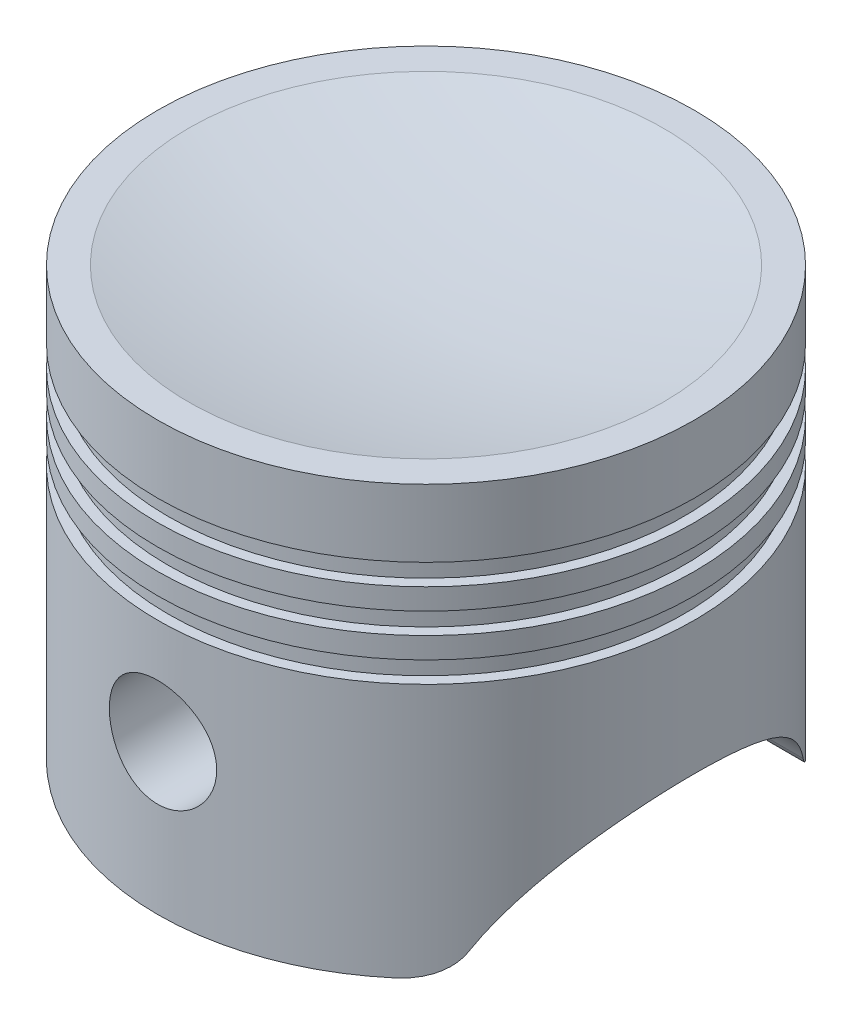
from build123d import *

# Parameters (mm, degrees)
SKETCH2_W                = 2.5
SKETCH2_H                = 5
LPATTERN1_COUNT          = 3
LPATTERN1_PITCH          = 10
CUT_EXTRUDE1_DEPTH       = 118.194667114
CUT_EXTRUDE1_DEPTH_BACK  = 118.194667114
SKETCH3_R                = 12.7
CUT_EXTRUDE3_DEPTH       = 118.194667288
CUT_EXTRUDE3_DEPTH_BACK  = 118.194667288
FILLET1_R                = 10
BOSS_EXTRUDE1_REACH      = 149.195
BOSS_EXTRUDE1_END_RADIUS = 57.15
BOSS_EXTRUDE1_START      = 30
SKETCH5_R                = 15.2
SKETCH5_R_2              = 12.7


with BuildPart() as part:
    # Sketch1 → Revolve1 (revolve)
    with BuildSketch(Plane.XY, mode=Mode.PRIVATE) as revolve1_sk:
        with BuildLine():
            Line((0, 19), (0, 0))
            Line((0, 0), (57.15, 0))
            Line((57.15, 0), (57.15, -75.3))
            Line((57.15, -75.3), (63.5, -75.3))
            Line((63.5, -75.3), (63.5, 26))
            Line((63.5, 26), (56.15, 26))
            ThreePointArc((56.15, 26), (28.278100119, 20.870846903), (0, 19))
        make_face()
    revolve(revolve1_sk.sketch.rotate(Axis((0, 19, 0), (0, -1, 0)), 180), axis=Axis((0, 19, 0), (0, -1, 0)))

    # Sketch2 → Cut-Revolve1 (revolve, cut)
    with BuildSketch(Plane.XY, mode=Mode.PRIVATE) as cut_revolve1_sk:
        with Locations((62.25, 7.5)):
            Rectangle(SKETCH2_W, SKETCH2_H)
    cut_revolve1 = revolve(cut_revolve1_sk.sketch.rotate(Axis((0, 0, 0), (0, 1, 0)), 180), axis=Axis((0, 0, 0), (0, 1, 0)), mode=Mode.SUBTRACT)

    # LPattern1: Cut-Revolve1 ×3
    with Locations(*[(0, -i * LPATTERN1_PITCH, 0) for i in range(1, LPATTERN1_COUNT)]):
        add(cut_revolve1, mode=Mode.SUBTRACT)

    # Sketch3 → Cut-Extrude1 (cut, two sides: drawn at the far end of the back side and taken through both)
    with BuildSketch(Plane.XY.offset(-CUT_EXTRUDE1_DEPTH_BACK)):
        with Locations((0, -40)):
            Circle(SKETCH3_R)
    extrude(amount=CUT_EXTRUDE1_DEPTH + CUT_EXTRUDE1_DEPTH_BACK, mode=Mode.SUBTRACT)

    # Sketch4 → Cut-Extrude3 (cut, two sides: drawn at the far end of the back side and taken through both)
    with BuildSketch(Plane(origin=(0, 0, 0), x_dir=(0, 0, -1), z_dir=(1, 0, 0)).offset(-CUT_EXTRUDE3_DEPTH_BACK)):
        with BuildLine():
            Line((-150.607887093, -357.651696515), (-42, -75.3))
            ThreePointArc((-42, -75.3), (0, -46.455494421), (42, -75.3))
            Line((42, -75.3), (150.607887093, -357.651696515))
            Line((150.607887093, -357.651696515), (150.607887093, -962.691046189))
            Line((150.607887093, -962.691046189), (-150.607887093, -962.691046189))
            Line((-150.607887093, -962.691046189), (-150.607887093, -357.651696515))
        make_face()
    extrude(amount=CUT_EXTRUDE3_DEPTH + CUT_EXTRUDE3_DEPTH_BACK, mode=Mode.SUBTRACT)

    # Fillet1
    # the kernel refuses this fillet: 10 mm, written as the material it takes off along each edge
    with BuildSketch(Plane(origin=(63.583013308, -75.3, 42), x_dir=(0, 0.9083807758809636, -0.41814395369286256), z_dir=(-1, 0, 0)), Plane(origin=(-22.800360105, -75.3, 42), x_dir=(0, 0.9083807758809636, -0.41814395369286256), z_dir=(-1, 0, 0))) as fillet1_piece_1:
        with BuildLine():
            CenterArc((6.414901106, -9.979403311), FILLET1_R, 93.67799309, 61.604544038)
            Line((-2.668906652, -5.797963774), (0, 0))
            ThreePointArc((0, 0), (2.886705498, -0.092685102), (5.773410996, 0))
        make_face()
    extrude(amount=40.782653203, mode=Mode.SUBTRACT)
    with BuildSketch(Plane(origin=(63.583013308, -75.3, -42), x_dir=(0, 0, -1), z_dir=(-1, 0, 0))) as fillet1_piece_2:
        with BuildLine():
            CenterArc((6.382746011, -10), FILLET1_R, 90, 61.604544038)
            ThreePointArc((-2.4141169, -5.24445556), (-1.122865085, -2.660983495), (0, 0))
            Line((0, 0), (6.382746011, 0))
        make_face()
    extrude(amount=40.782653203, mode=Mode.SUBTRACT)
    with BuildSketch(Plane(origin=(-22.800360105, -75.3, -42), x_dir=(0, 0.9083807758809641, 0.4181439536928614), z_dir=(-1, 0, 0))) as fillet1_piece_3:
        with BuildLine():
            CenterArc((6.414901106, 9.979403311), FILLET1_R, 204.717462871, 61.604544038)
            Line((-2.668906652, 5.797963774), (0, 0))
            ThreePointArc((0, 0), (2.886705498, 0.092685102), (5.773410996, 0))
        make_face()
    extrude(amount=40.782653203, mode=Mode.SUBTRACT)

    # Boss-Extrude1: up to this cylinder (the profile starts inside it)
    boss_extrude1_end = Plane(origin=(0, -40, 0), z_dir=(0, 1, 0)) * Cylinder(BOSS_EXTRUDE1_END_RADIUS, 413.69, mode=Mode.PRIVATE)
    # Sketch5 → Boss-Extrude1 (add, up to the surface)
    with BuildSketch(Plane.XY.offset(BOSS_EXTRUDE1_START), mode=Mode.PRIVATE) as boss_extrude1_sk1:
        with Locations(Location((0, -40, 0), (0, 0, 180))):
            Circle(SKETCH5_R)
        with Locations((0, -40)):
            Circle(SKETCH5_R_2, mode=Mode.SUBTRACT)
    boss_extrude1_tool1 = extrude(boss_extrude1_sk1.sketch, amount=BOSS_EXTRUDE1_REACH, mode=Mode.PRIVATE) & boss_extrude1_end
    boss_extrude1 = boss_extrude1_tool1.solids().sort_by_distance((14.770079, -40, 30))[0]
    add(boss_extrude1)

    # Mirror1: Boss-Extrude1 across plane
    add(boss_extrude1.mirror(Plane.XY))


solid = part.part
